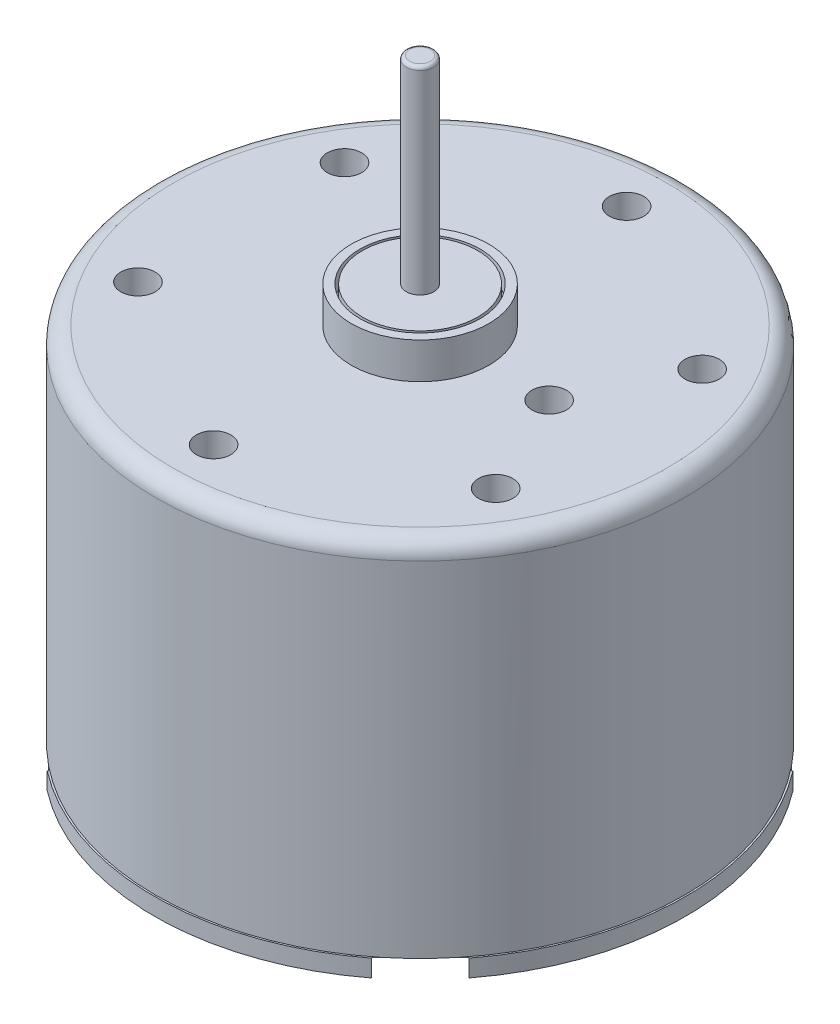
from build123d import *

# Parameters (mm, degrees)
ESBO_O1_R                  = 15.35
RESSALTO_EXTRUS_O1_DEPTH   = 21
ESBO_O2_R                  = 4
RESSALTO_EXTRUS_O2_DEPTH   = 2.1
ESBO_O3_R                  = 3.5
ESBO_O3_R_2                = 3.35
CORTE_EXTRUS_O1_DEPTH      = 1
ESBO_O4_R                  = 0.8
RESSALTO_EXTRUS_O3_DEPTH   = 11.5
FILETE1_R                  = 0.2
ESBO_O5_R                  = 1
CORTE_EXTRUS_O2_DEPTH      = 3
ESBO_O6_R                  = 1
CORTE_EXTRUS_O3_DEPTH      = 3
FILETE2_R                  = 1
ESBO_O7_R                  = 15.45
RESSALTO_EXTRUS_O4_DEPTH   = 1
CORTE_EXTRUS_O4_DEPTH      = 1.5
RESSALTO_EXTRUS_O5_START   = 2
ESBO_O9_R                  = 4
RESSALTO_EXTRUS_O5_DEPTH   = 2
CORTE_EXTRUS_O5_DEPTH      = 41.499567983
CORTE_EXTRUS_O5_DEPTH_BACK = 3.5
ESBO_O10_R                 = 3.5
ESBO_O11_R                 = 1.25
RESSALTO_EXTRUS_O6_DEPTH   = 4
CORTE_EXTRUS_O6_DEPTH      = 0.5
RESSALTO_EXTRUS_O7_DEPTH   = 3
ESBO_O15_R                 = 0.5
CORTE_EXTRUS_O7_DEPTH      = 46.395818321
FILETE3_R                  = 0.25
CORTE_EXTRUS_O8_DEPTH      = 1
CHANFRO1_SIZE              = 1.962610506
CHANFRO1_SIZE_2            = 1


with BuildPart() as part:
    # Esboço1 → Ressalto-extrusão1 (new body)
    with BuildSketch(Plane(origin=(0, 0, 0), x_dir=(1, 0, 0), z_dir=(0, 1, 0))):
        with Locations(Location((0, 0, 0), (0, 0, 90))):
            Circle(ESBO_O1_R)
    extrude(amount=RESSALTO_EXTRUS_O1_DEPTH)

    # Esboço2 → Ressalto-extrusão2 (add)
    with BuildSketch(Plane(origin=(0, 21, 0), x_dir=(1, 0, 0), z_dir=(0, 1, 0))):
        with Locations(Location((0, 0, 0), (0, 0, 270))):
            Circle(ESBO_O2_R)
    extrude(amount=RESSALTO_EXTRUS_O2_DEPTH)

    # Esboço3 → Corte-extrusão1 (cut)
    with BuildSketch(Plane(origin=(0, 23.1, 0), x_dir=(1, 0, 0), z_dir=(0, 1, 0))):
        with Locations(Location((0, 0, 0), (0, 0, 270))):
            Circle(ESBO_O3_R)
        with Locations(Location((0, 0, 0), (0, 0, 270))):
            Circle(ESBO_O3_R_2, mode=Mode.SUBTRACT)
    extrude(amount=-CORTE_EXTRUS_O1_DEPTH, mode=Mode.SUBTRACT)

    # Esboço4 → Ressalto-extrusão3 (add)
    with BuildSketch(Plane(origin=(0, 23.1, 0), x_dir=(1, 0, 0), z_dir=(0, 1, 0))):
        with Locations(Location((0, 0, 0), (0, 0, 270))):
            Circle(ESBO_O4_R)
    extrude(amount=RESSALTO_EXTRUS_O3_DEPTH)

    # Filete1
    filete1_edges = [part.edges().sort_by_distance(p)[0] for p in [
        (0, 34.6, -0.8),
    ]]
    fillet(filete1_edges, radius=FILETE1_R)

    # Esboço5 → Corte-extrusão2 (cut)
    with BuildSketch(Plane(origin=(0, 21, 0), x_dir=(1, 0, 0), z_dir=(0, 1, 0))):
        with Locations(Location((0, 12, 0), (0, 0, 270))):
            Circle(ESBO_O5_R)
        with Locations(Location((10.392304845, 6, 0), (0, 0, 270))):
            Circle(ESBO_O5_R)
        with Locations(Location((10.392304845, -6, 0), (0, 0, 270))):
            Circle(ESBO_O5_R)
        with Locations(Location((0, -12, 0), (0, 0, 270))):
            Circle(ESBO_O5_R)
        with Locations(Location((-10.392304845, -6, 0), (0, 0, 270))):
            Circle(ESBO_O5_R)
        with Locations(Location((-10.392304845, 6, 0), (0, 0, 270))):
            Circle(ESBO_O5_R)
    extrude(amount=-CORTE_EXTRUS_O2_DEPTH, mode=Mode.SUBTRACT)

    # Esboço6 → Corte-extrusão3 (cut)
    with BuildSketch(Plane(origin=(0, 21, 0), x_dir=(1, 0, 0), z_dir=(0, 1, 0))):
        with Locations(Location((7.5, 0, 0), (0, 0, 270))):
            Circle(ESBO_O6_R)
    extrude(amount=-CORTE_EXTRUS_O3_DEPTH, mode=Mode.SUBTRACT)

    # Filete2
    filete2_edges = [part.edges().sort_by_distance(p)[0] for p in [
        (0, 21, 15.35),
    ]]
    fillet(filete2_edges, radius=FILETE2_R)

    # Esboço7 → Ressalto-extrusão4 (add)
    with BuildSketch(Plane.XZ):
        with Locations(Location((0, 0, 0), (0, 0, 270))):
            Circle(ESBO_O7_R)
    extrude(amount=RESSALTO_EXTRUS_O4_DEPTH)

    # Esboço8 → Corte-extrusão4 (cut)
    with BuildSketch(Plane.XZ.offset(1)):
        with BuildLine():
            Line((-11.258330249, 6.5), (-5.196152423, 3))
            ThreePointArc((-5.196152423, 3), (-6, 0), (-5.196152423, -3))
            Line((-5.196152423, -3), (-11.258330249, -6.5))
            ThreePointArc((-11.258330249, -6.5), (0, -13), (11.258330249, -6.5))
            Line((11.258330249, -6.5), (5.196152423, -3))
            ThreePointArc((5.196152423, -3), (6, 0), (5.196152423, 3))
            Line((5.196152423, 3), (11.258330249, 6.5))
            ThreePointArc((11.258330249, 6.5), (0, 13), (-11.258330249, 6.5))
        make_face()
    extrude(amount=-CORTE_EXTRUS_O4_DEPTH, mode=Mode.SUBTRACT)

    # Esboço9 → Ressalto-extrusão5 (add)
    with BuildSketch(Plane.XZ.offset(-0.5).offset(RESSALTO_EXTRUS_O5_START)):
        with Locations(Location((0, 0, 0), (0, 0, 90))):
            Circle(ESBO_O9_R)
    extrude(amount=-RESSALTO_EXTRUS_O5_DEPTH)

    # Esboço10 → Corte-extrusão5 (cut, two sides: drawn at the far end of the back side and taken through both)
    with BuildSketch(Plane.XZ.offset(-0.5).offset(-CORTE_EXTRUS_O5_DEPTH_BACK)):
        with Locations(Location((-3, 10, 0), (0, 0, 57.495744103))):
            Circle(ESBO_O10_R)
        with Locations(Location((3, -10, 0), (0, 0, 335.902744365))):
            Circle(ESBO_O10_R)
    extrude(amount=CORTE_EXTRUS_O5_DEPTH + CORTE_EXTRUS_O5_DEPTH_BACK, mode=Mode.SUBTRACT)

    # Esboço11 → Ressalto-extrusão6 (add)
    with BuildSketch(Plane.XZ.offset(-4)):
        with Locations(Location((-3, 10, 0), (0, 0, 270))):
            Circle(ESBO_O11_R)
        with Locations(Location((3, -10, 0), (0, 0, 270))):
            Circle(ESBO_O11_R)
    extrude(amount=RESSALTO_EXTRUS_O6_DEPTH)

    # Esboço12 → Corte-extrusão6 (cut)
    with BuildSketch(Plane.XZ.offset(1)):
        Polygon((-6.498994273, -3.002178116), (-7.158511662, -0.075569701), (-13.011728492, -1.394604479), (-12.352211103, -4.321212894), align=None)
        Polygon((13.011728492, 1.394604479), (7.158511662, 0.075569701), (6.498994273, 3.002178116), (12.352211103, 4.321212894), align=None)
    extrude(amount=-CORTE_EXTRUS_O6_DEPTH, mode=Mode.SUBTRACT)

    # Esboço13 → Ressalto-extrusão7 (add)
    with BuildSketch(Plane.XZ.offset(0.5)):
        Polygon((-8.024128236, -0.7831769), (-7.584449976, -2.734249176), (-8.072218045, -2.844168741), (-8.511896305, -0.893096465), align=None)
        Polygon((8.511896305, 0.893096465), (8.024128236, 0.7831769), (7.584449976, 2.734249176), (8.072218045, 2.844168741), align=None)
    extrude(amount=RESSALTO_EXTRUS_O7_DEPTH)

    # Esboço15 → Corte-extrusão7 (cut, through all)
    with BuildSketch(Plane(origin=(-8.292057175, 0, -1.868632603), x_dir=(-0.21983912974654451, 0, 0.9755361382502865), z_dir=(-0.9755361382502864, 0, -0.2198391297465445))):
        with Locations((0, -2.5)):
            Circle(ESBO_O15_R)
    extrude(amount=-CORTE_EXTRUS_O7_DEPTH, mode=Mode.SUBTRACT)

    # Filete3
    filete3_edges = [part.edges().sort_by_distance(p)[0] for p in [
        (-8.26801227, -3.5, -0.838136682),
        (-7.828334011, -3.5, -2.789208959),
        (7.828334011, -3.5, 2.789208959),
        (8.26801227, -3.5, 0.838136682),
    ]]
    fillet(filete3_edges, radius=FILETE3_R)

    # Esboço16 → Corte-extrusão8 (cut)
    with BuildSketch(Plane.XZ.offset(1)):
        with BuildLine():
            Line((-12.270225276, 9.441798151), (-10.818733752, 7.990306627))
            Line((-10.818733752, 7.990306627), (-7.990306627, 10.818733752))
            Line((-7.990306627, 10.818733752), (-9.441798151, 12.270225276))
            ThreePointArc((-9.441798151, 12.270225276), (-10.947739051, 10.947739051), (-12.270225276, 9.441798151))
        make_face()
        with BuildLine():
            Line((7.990306627, 10.818733752), (9.441798151, 12.270225276))
            ThreePointArc((9.441798151, 12.270225276), (10.947739051, 10.947739051), (12.270225276, 9.441798151))
            Line((12.270225276, 9.441798151), (10.818733752, 7.990306627))
            Line((10.818733752, 7.990306627), (7.990306627, 10.818733752))
        make_face()
        with BuildLine():
            Line((12.270225276, -9.441798151), (10.818733752, -7.990306627))
            Line((10.818733752, -7.990306627), (7.990306627, -10.818733752))
            Line((7.990306627, -10.818733752), (9.441798151, -12.270225276))
            ThreePointArc((9.441798151, -12.270225276), (10.947739051, -10.947739051), (12.270225276, -9.441798151))
        make_face()
        with BuildLine():
            Line((-7.990306627, -10.818733752), (-9.441798151, -12.270225276))
            ThreePointArc((-9.441798151, -12.270225276), (-10.947739051, -10.947739051), (-12.270225276, -9.441798151))
            Line((-12.270225276, -9.441798151), (-10.818733752, -7.990306627))
            Line((-10.818733752, -7.990306627), (-7.990306627, -10.818733752))
        make_face()
    extrude(amount=-CORTE_EXTRUS_O8_DEPTH, mode=Mode.SUBTRACT)

    # Chanfro1
    # the kernel refuses this chamfer: 1.962610506, 1 mm, written as the material it adds along each edge
    with BuildSketch(Plane(origin=(10.818733752, 0, 7.990306627), x_dir=(0.7069981009602014, 0.017531984409911067, 0.7069981009601932), z_dir=(-0.7071067811865435, 0, 0.7071067811865517)), Plane(origin=(-10.818733752, 0, -7.990306627), x_dir=(-0.7069981009602017, 0.01753198440991109, -0.7069981009601931), z_dir=(0.7071067811865432, 0, -0.7071067811865519))) as chanfro1_piece_1:
        Polygon((CHANFRO1_SIZE * 0.999846302698, -CHANFRO1_SIZE * 0.0175319844055), (-CHANFRO1_SIZE_2 * 0.0175319844099, -CHANFRO1_SIZE_2 * 0.99984630295), (0, 0), align=None)
    extrude(amount=4)
    with BuildSketch(Plane(origin=(10.818733752, 0, -7.990306627), x_dir=(0.7069981009602014, 0.017531984409911067, -0.7069981009601932), z_dir=(-0.7071067811865435, 0, -0.7071067811865517)), Plane(origin=(-10.818733752, 0, 7.990306627), x_dir=(-0.7069981009602017, 0.01753198440991109, 0.7069981009601931), z_dir=(0.7071067811865432, 0, 0.7071067811865519))) as chanfro1_piece_2:
        Polygon((CHANFRO1_SIZE * 0.999846302698, CHANFRO1_SIZE * 0.0175319844055), (-CHANFRO1_SIZE_2 * 0.0175319844099, CHANFRO1_SIZE_2 * 0.99984630295), (0, 0), align=None)
    extrude(amount=4)


solid = part.part
